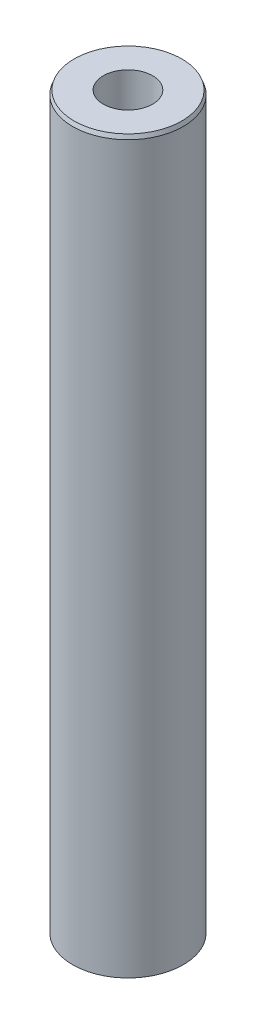
from build123d import *
from OCP.BRepFilletAPI import BRepFilletAPI_MakeChamfer

# Parameters (mm, degrees)
SKETCH1_R           = 12.5
BOSS_EXTRUDE1_DEPTH = 165.317608699
SKETCH2_R           = 5.57673123
CUT_EXTRUDE1_DEPTH  = 167.260072615
CHAMFER1_SIZE       = 0.913223017
CHAMFER1_SIZE2      = 0.333913215


with BuildPart() as part:
    # Sketch1 → Boss-Extrude1 (new body)
    with BuildSketch(Plane(origin=(0, 0, 0), x_dir=(1, 0, 0), z_dir=(0, 1, 0))):
        Circle(SKETCH1_R)
    extrude(amount=BOSS_EXTRUDE1_DEPTH)

    # Sketch2 → Cut-Extrude1 (cut, through all)
    with BuildSketch(Plane(origin=(0, 0, 0), x_dir=(1, 0, 0), z_dir=(0, 1, 0))):
        Circle(SKETCH2_R)
    extrude(amount=CUT_EXTRUDE1_DEPTH, mode=Mode.SUBTRACT)

    # Chamfer1: one chamfer whose edges measure the first distance from different faces: ONE call of the kernel's chamfer builder (chamfer() names one face for all edges)
    chamfer1_edges_1 = [part.edges().sort_by_distance(p)[0] for p in [
        (-12.5, 165.317608699, 0),
    ]]
    chamfer1_side_1 = [part.faces().sort_by_distance(p)[0] for p in [
        (-12.5, 82.65880435, 0),
    ]]
    chamfer1_edges_2 = [part.edges().sort_by_distance(p)[0] for p in [
        (-12.5, 0, 0),
    ]]
    chamfer1_side_2 = [part.faces().sort_by_distance(p)[0] for p in [
        (-12.146446609, 0, 0),
    ]]
    chamfer1 = BRepFilletAPI_MakeChamfer(part.part.solid().wrapped)
    for e in chamfer1_edges_1:
        chamfer1.Add(CHAMFER1_SIZE, CHAMFER1_SIZE2, e.wrapped, chamfer1_side_1[0].wrapped)  # the first distance lies on this face
    for e in chamfer1_edges_2:
        chamfer1.Add(CHAMFER1_SIZE, CHAMFER1_SIZE2, e.wrapped, chamfer1_side_2[0].wrapped)  # the first distance lies on this face
    add(Compound.cast(chamfer1.Shape()), mode=Mode.REPLACE)


solid = part.part
